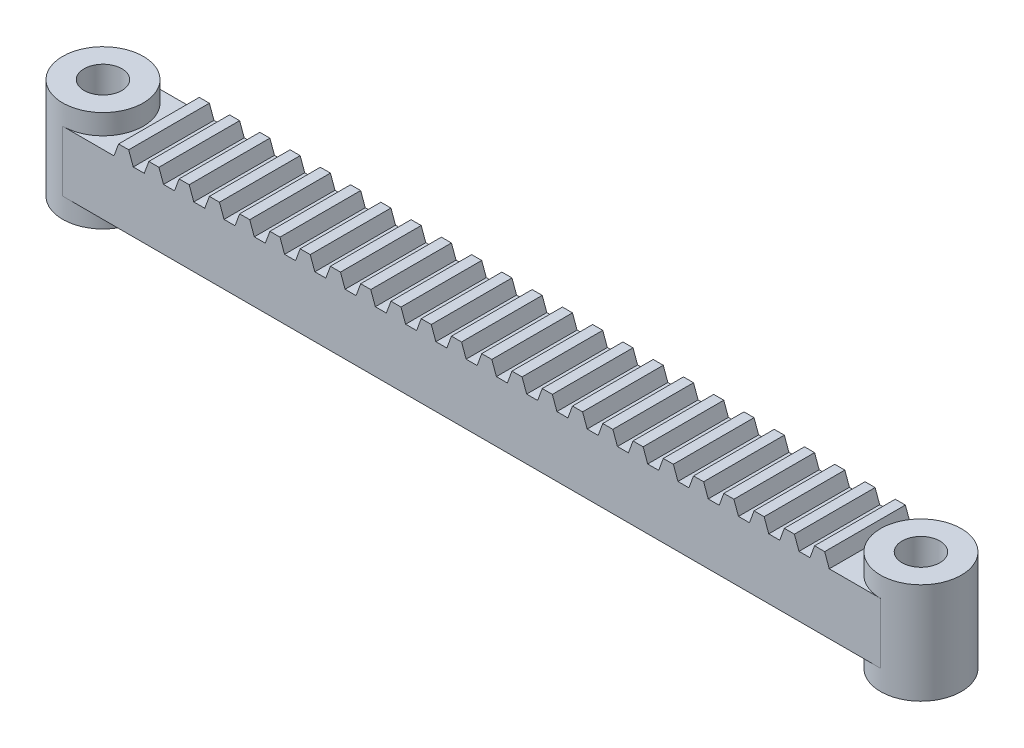
from build123d import *
from build123d.topology import SkipClean

# Parameters (mm, degrees)
BOSS_EXTRUDE1_DEPTH = 16
SKETCH3_R           = 3.75
CUT_EXTRUDE1_DEPTH  = 16
SKETCH4_R           = 8
SKETCH4_R_2         = 3.75
BOSS_EXTRUDE2_DEPTH = 16
BOSS_EXTRUDE3_START = 4
SKETCH5_R           = 3.75
BOSS_EXTRUDE3_DEPTH = 4
SKETCH6_R           = 8
SKETCH6_R_2         = 3.75
BOSS_EXTRUDE4_DEPTH = 16
SKETCH7_R           = 3.75
CUT_EXTRUDE2_DEPTH  = 16
BOSS_EXTRUDE5_START = 4
SKETCH8_R           = 3.75
BOSS_EXTRUDE5_DEPTH = 4


with BuildPart() as part:
    # Sketch1 → Boss-Extrude1 (new body)
    with BuildSketch(Plane.XY):
        Polygon((83.771892596, 8.5), (81.771892596, 8.5), (80.86196701, 6), (78.681818182, 6), (77.771892596, 8.5), (75.771892596, 8.5), (74.86196701, 6), (72.681818182, 6), (71.771892596, 8.5), (69.771892596, 8.5), (68.86196701, 6), (66.681818182, 6), (65.771892596, 8.5), (63.771892596, 8.5), (62.86196701, 6), (60.681818182, 6), (59.771892596, 8.5), (57.771892596, 8.5), (56.86196701, 6), (54.681818182, 6), (53.771892596, 8.5), (51.771892596, 8.5), (50.86196701, 6), (48.681818182, 6), (47.771892596, 8.5), (45.771892596, 8.5), (44.86196701, 6), (42.681818182, 6), (41.771892596, 8.5), (39.771892596, 8.5), (38.86196701, 6), (36.681818182, 6), (35.771892596, 8.5), (33.771892596, 8.5), (32.86196701, 6), (30.681818182, 6), (29.771892596, 8.5), (27.771892596, 8.5), (26.86196701, 6), (24.681818182, 6), (23.771892596, 8.5), (21.771892596, 8.5), (20.86196701, 6), (18.681818182, 6), (17.771892596, 8.5), (15.771892596, 8.5), (14.86196701, 6), (12.681818182, 6), (11.771892596, 8.5), (9.771892596, 8.5), (8.86196701, 6), (6.681818182, 6), (5.771892596, 8.5), (3.771892596, 8.5), (2.86196701, 6), (0.681818182, 6), (-0.228107404, 8.5), (-2.228107404, 8.5), (-3.13803299, 6), (-5.318181818, 6), (-6.228107404, 8.5), (-8.228107404, 8.5), (-9.13803299, 6), (-11.318181818, 6), (-12.228107404, 8.5), (-14.228107404, 8.5), (-15.13803299, 6), (-17.318181818, 6), (-18.228107404, 8.5), (-20.228107404, 8.5), (-21.13803299, 6), (-23.318181818, 6), (-24.228107404, 8.5), (-26.228107404, 8.5), (-27.13803299, 6), (-29.318181818, 6), (-30.228107404, 8.5), (-32.228107404, 8.5), (-33.13803299, 6), (-35.318181818, 6), (-36.228107404, 8.5), (-38.228107404, 8.5), (-39.13803299, 6), (-41.318181818, 6), (-42.228107404, 8.5), (-44.228107404, 8.5), (-45.13803299, 6), (-47.318181818, 6), (-48.228107404, 8.5), (-50.228107404, 8.5), (-51.13803299, 6), (-53.318181818, 6), (-54.228107404, 8.5), (-56.228107404, 8.5), (-57.13803299, 6), (-75.13803299, 6), (-75.13803299, -6), (102.681818182, -6), (102.681818182, 6), (84.681818182, 6), align=None)
    extrude(amount=BOSS_EXTRUDE1_DEPTH)

    # Sketch3 → Cut-Extrude1 (cut)
    with BuildSketch(Plane(origin=(0, 6, 0), x_dir=(1, 0, 0), z_dir=(0, 1, 0))):
        with BuildLine():
            ThreePointArc((94.86196701, 0), (102.86196701, -8), (94.86196701, -16))
            Line((94.86196701, -16), (91.310905943, -17.982667731))
            Line((91.310905943, -17.982667731), (106.371238817, -17.331958931))
            Line((106.371238817, -17.331958931), (104.42249812, 2.008331966))
            Line((104.42249812, 2.008331966), (94.86196701, 0))
        make_face()
        with Locations((94.86196701, -8)):
            Circle(SKETCH3_R)
    extrude(amount=-CUT_EXTRUDE1_DEPTH, mode=Mode.SUBTRACT)

    # Sketch4 → Boss-Extrude2 (add)
    with SkipClean():  # the faces are left unmerged after this step: merging them gives an invalid solid
        with BuildSketch(Plane(origin=(0, 6, 0), x_dir=(1, 0, 0), z_dir=(0, 1, 0))):
            with Locations((94.86196701, -8)):
                Circle(SKETCH4_R)
            with Locations((94.86196701, -8)):
                Circle(SKETCH4_R_2, mode=Mode.SUBTRACT)
        extrude(amount=-BOSS_EXTRUDE2_DEPTH)

    # Sketch5 → Boss-Extrude3 (add)
    with SkipClean():  # the faces are left unmerged after this step: merging them gives an invalid solid
        with BuildSketch(Plane(origin=(0, 6, 0), x_dir=(1, 0, 0), z_dir=(0, 1, 0)).offset(BOSS_EXTRUDE3_START)):
            with BuildLine():
                ThreePointArc((94.86196701, 0), (86.86196701, -8), (94.86196701, -16))
                ThreePointArc((94.86196701, -16), (100.51882126, -13.656854249), (102.86196701, -8))
                ThreePointArc((102.86196701, -8), (100.51882126, -2.343145751), (94.86196701, 0))
            make_face()
            with Locations((94.86196701, -8)):
                Circle(SKETCH5_R, mode=Mode.SUBTRACT)
        extrude(amount=-BOSS_EXTRUDE3_DEPTH)

    # Sketch6 → Boss-Extrude4 (add)
    with SkipClean():  # the faces are left unmerged after this step: merging them gives an invalid solid
        with BuildSketch(Plane(origin=(0, 6, 0), x_dir=(1, 0, 0), z_dir=(0, 1, 0))):
            with Locations((-67.318181818, -8)):
                Circle(SKETCH6_R)
            with Locations((-67.318181818, -8)):
                Circle(SKETCH6_R_2, mode=Mode.SUBTRACT)
        extrude(amount=-BOSS_EXTRUDE4_DEPTH)

    # Sketch7 → Cut-Extrude2 (cut)
    with SkipClean():  # the faces are left unmerged after this step: merging them gives an invalid solid
        with BuildSketch(Plane(origin=(0, 6, 0), x_dir=(1, 0, 0), z_dir=(0, 1, 0))):
            with BuildLine():
                Line((-67.318181818, 0), (-75.13803299, 0))
                Line((-75.13803299, 0), (-75.13803299, -6.311827124))
                ThreePointArc((-75.13803299, -6.311827124), (-72.342851807, -1.774834018), (-67.318181818, 0))
            make_face()
            with BuildLine():
                ThreePointArc((-67.318181818, -16), (-72.342851807, -14.225165982), (-75.13803299, -9.688172876))
                Line((-75.13803299, -9.688172876), (-75.13803299, -16))
                Line((-75.13803299, -16), (-67.318181818, -16))
            make_face()
            with Locations((-67.318181818, -8)):
                Circle(SKETCH7_R)
        extrude(amount=-CUT_EXTRUDE2_DEPTH, mode=Mode.SUBTRACT)

    # Sketch8 → Boss-Extrude5 (add)
    with SkipClean():  # the faces are left unmerged after this step: merging them gives an invalid solid
        with BuildSketch(Plane(origin=(0, 6, 0), x_dir=(1, 0, 0), z_dir=(0, 1, 0)).offset(BOSS_EXTRUDE5_START)):
            with BuildLine():
                ThreePointArc((-59.318181818, -8), (-61.661327569, -2.343145751), (-67.318181818, 0))
                ThreePointArc((-67.318181818, 0), (-75.318181818, -8), (-67.318181818, -16))
                ThreePointArc((-67.318181818, -16), (-61.661327569, -13.656854249), (-59.318181818, -8))
            make_face()
            with Locations((-67.318181818, -8)):
                Circle(SKETCH8_R, mode=Mode.SUBTRACT)
        extrude(amount=-BOSS_EXTRUDE5_DEPTH)


solid = part.part
